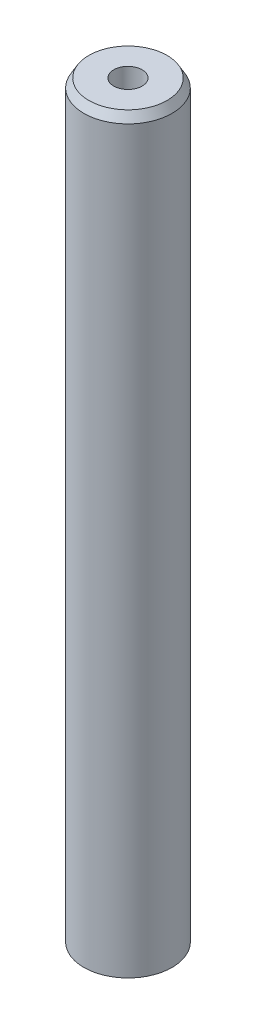
from build123d import *
from OCP.BRepFilletAPI import BRepFilletAPI_MakeChamfer

# Parameters (mm, degrees)
SKETCH1_R           = 5
BOSS_EXTRUDE1_DEPTH = 85.397027455
SKETCH2_R           = 1.608833781
CUT_EXTRUDE1_DEPTH  = 86.689277614
CHAMFER1_SIZE       = 0.983474556
CHAMFER1_SIZE2      = 0.567809299


with BuildPart() as part:
    # Sketch1 → Boss-Extrude1 (new body)
    with BuildSketch(Plane(origin=(0, 0, 0), x_dir=(1, 0, 0), z_dir=(0, 1, 0))):
        Circle(SKETCH1_R)
    extrude(amount=BOSS_EXTRUDE1_DEPTH)

    # Sketch2 → Cut-Extrude1 (cut, through all)
    with BuildSketch(Plane(origin=(0, 0, 0), x_dir=(1, 0, 0), z_dir=(0, 1, 0))):
        Circle(SKETCH2_R)
    extrude(amount=CUT_EXTRUDE1_DEPTH, mode=Mode.SUBTRACT)

    # Chamfer1: one chamfer whose edges measure the first distance from different faces: ONE call of the kernel's chamfer builder (chamfer() names one face for all edges)
    chamfer1_edges_1 = [part.edges().sort_by_distance(p)[0] for p in [
        (-5, 85.397027455, 0),
    ]]
    chamfer1_side_1 = [part.faces().sort_by_distance(p)[0] for p in [
        (-5, 42.698513727, 0),
    ]]
    chamfer1_edges_2 = [part.edges().sort_by_distance(p)[0] for p in [
        (-5, 0, 0),
    ]]
    chamfer1_side_2 = [part.faces().sort_by_distance(p)[0] for p in [
        (-4.858578644, 0, 0),
    ]]
    chamfer1 = BRepFilletAPI_MakeChamfer(part.part.solid().wrapped)
    for e in chamfer1_edges_1:
        chamfer1.Add(CHAMFER1_SIZE, CHAMFER1_SIZE2, e.wrapped, chamfer1_side_1[0].wrapped)  # the first distance lies on this face
    for e in chamfer1_edges_2:
        chamfer1.Add(CHAMFER1_SIZE, CHAMFER1_SIZE2, e.wrapped, chamfer1_side_2[0].wrapped)  # the first distance lies on this face
    add(Compound.cast(chamfer1.Shape()), mode=Mode.REPLACE)


solid = part.part
